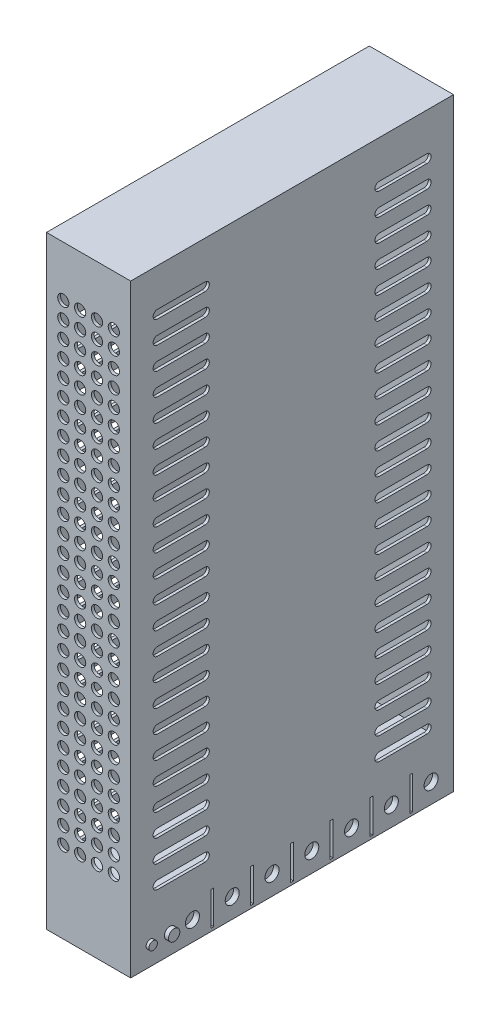
from build123d import *

# Parameters (mm, degrees)
SKETCH1_W            = 30
SKETCH1_H            = 201
CASE_2_DEPTH         = 115
CASE_SHELL_T         = 1
SKETCH2_W            = 30
SKETCH2_H            = 14
TERMINAL_BLOCK_DEPTH = 115
SKETCH3_R            = 2
POT_DEPTH            = 1.5
SKETCH4_R            = 1.5
LED_DEPTH            = 1
SKETCH5_R            = 2
PERFORATION_DEPTH    = 1
VENTS_R_DEPTH        = 1
VENTS_L_START        = 1
VENTS_L_DEPTH        = 1
SKETCH8_R            = 2.5
SCREWS_DEPTH         = 2
SKETCH9_W            = 1
SKETCH9_H            = 12
BARRIERS_DEPTH       = 3


with BuildPart() as part:
    # Sketch1 → Case 2 (new body)
    with BuildSketch(Plane.XY):
        with Locations((0, 114.5)):
            Rectangle(SKETCH1_W, SKETCH1_H)
    extrude(amount=CASE_2_DEPTH)

    # Case_shell (no face opened: a closed hollow body)
    add(offset(amount=-CASE_SHELL_T, mode=Mode.PRIVATE), mode=Mode.SUBTRACT)

    # Sketch2 → Terminal_block (add)
    with BuildSketch(Plane.XY):
        with Locations((0, 7)):
            Rectangle(SKETCH2_W, SKETCH2_H)
    extrude(amount=TERMINAL_BLOCK_DEPTH)

    # Sketch3 → Pot (add)
    with BuildSketch(Plane(origin=(15, 0, 0), x_dir=(0, 0, -1), z_dir=(1, 0, 0))):
        with Locations((-101, 7)):
            Circle(SKETCH3_R)
    extrude(amount=POT_DEPTH)

    # Sketch4 → LED (add)
    with BuildSketch(Plane(origin=(15, 0, 0), x_dir=(0, 0, -1), z_dir=(1, 0, 0))):
        with Locations((-108, 7)):
            Circle(SKETCH4_R)
    extrude(amount=LED_DEPTH)

    # Sketch5 → Perforation (cut)
    with BuildSketch(Plane.XY.offset(115)):
        with Locations((-9, 29)):
            Circle(SKETCH5_R)
        with Locations((-9, 35)):
            Circle(SKETCH5_R)
        with Locations((-9, 41)):
            Circle(SKETCH5_R)
        with Locations((-9, 47)):
            Circle(SKETCH5_R)
        with Locations((-9, 53)):
            Circle(SKETCH5_R)
        with Locations((-9, 59)):
            Circle(SKETCH5_R)
        with Locations((-9, 65)):
            Circle(SKETCH5_R)
        with Locations((-9, 71)):
            Circle(SKETCH5_R)
        with Locations((-9, 77)):
            Circle(SKETCH5_R)
        with Locations((-9, 83)):
            Circle(SKETCH5_R)
        with Locations((-9, 89)):
            Circle(SKETCH5_R)
        with Locations((-9, 95)):
            Circle(SKETCH5_R)
        with Locations((-9, 101)):
            Circle(SKETCH5_R)
        with Locations((-9, 107)):
            Circle(SKETCH5_R)
        with Locations((-9, 113)):
            Circle(SKETCH5_R)
        with Locations((-9, 119)):
            Circle(SKETCH5_R)
        with Locations((-9, 125)):
            Circle(SKETCH5_R)
        with Locations((-9, 131)):
            Circle(SKETCH5_R)
        with Locations((-9, 137)):
            Circle(SKETCH5_R)
        with Locations((-9, 143)):
            Circle(SKETCH5_R)
        with Locations((-9, 149)):
            Circle(SKETCH5_R)
        with Locations((-9, 155)):
            Circle(SKETCH5_R)
        with Locations((-9, 161)):
            Circle(SKETCH5_R)
        with Locations((-9, 167)):
            Circle(SKETCH5_R)
        with Locations((-9, 173)):
            Circle(SKETCH5_R)
        with Locations((-9, 179)):
            Circle(SKETCH5_R)
        with Locations((-9, 185)):
            Circle(SKETCH5_R)
        with Locations((-9, 191)):
            Circle(SKETCH5_R)
        with Locations((-9, 197)):
            Circle(SKETCH5_R)
        with Locations((-3, 29)):
            Circle(SKETCH5_R)
        with Locations((-3, 35)):
            Circle(SKETCH5_R)
        with Locations((-3, 41)):
            Circle(SKETCH5_R)
        with Locations((-3, 47)):
            Circle(SKETCH5_R)
        with Locations((-3, 53)):
            Circle(SKETCH5_R)
        with Locations((-3, 59)):
            Circle(SKETCH5_R)
        with Locations((-3, 65)):
            Circle(SKETCH5_R)
        with Locations((-3, 71)):
            Circle(SKETCH5_R)
        with Locations((-3, 77)):
            Circle(SKETCH5_R)
        with Locations((-3, 83)):
            Circle(SKETCH5_R)
        with Locations((-3, 89)):
            Circle(SKETCH5_R)
        with Locations((-3, 95)):
            Circle(SKETCH5_R)
        with Locations((-3, 101)):
            Circle(SKETCH5_R)
        with Locations((-3, 107)):
            Circle(SKETCH5_R)
        with Locations((-3, 113)):
            Circle(SKETCH5_R)
        with Locations((-3, 119)):
            Circle(SKETCH5_R)
        with Locations((-3, 125)):
            Circle(SKETCH5_R)
        with Locations((-3, 131)):
            Circle(SKETCH5_R)
        with Locations((-3, 137)):
            Circle(SKETCH5_R)
        with Locations((-3, 143)):
            Circle(SKETCH5_R)
        with Locations((-3, 149)):
            Circle(SKETCH5_R)
        with Locations((-3, 155)):
            Circle(SKETCH5_R)
        with Locations((-3, 161)):
            Circle(SKETCH5_R)
        with Locations((-3, 167)):
            Circle(SKETCH5_R)
        with Locations((-3, 173)):
            Circle(SKETCH5_R)
        with Locations((-3, 179)):
            Circle(SKETCH5_R)
        with Locations((-3, 185)):
            Circle(SKETCH5_R)
        with Locations((-3, 191)):
            Circle(SKETCH5_R)
        with Locations((-3, 197)):
            Circle(SKETCH5_R)
        with Locations((3, 29)):
            Circle(SKETCH5_R)
        with Locations((3, 35)):
            Circle(SKETCH5_R)
        with Locations((3, 41)):
            Circle(SKETCH5_R)
        with Locations((3, 47)):
            Circle(SKETCH5_R)
        with Locations((3, 53)):
            Circle(SKETCH5_R)
        with Locations((3, 59)):
            Circle(SKETCH5_R)
        with Locations((3, 65)):
            Circle(SKETCH5_R)
        with Locations((3, 71)):
            Circle(SKETCH5_R)
        with Locations((3, 77)):
            Circle(SKETCH5_R)
        with Locations((3, 83)):
            Circle(SKETCH5_R)
        with Locations((3, 89)):
            Circle(SKETCH5_R)
        with Locations((3, 95)):
            Circle(SKETCH5_R)
        with Locations((3, 101)):
            Circle(SKETCH5_R)
        with Locations((3, 107)):
            Circle(SKETCH5_R)
        with Locations((3, 113)):
            Circle(SKETCH5_R)
        with Locations((3, 119)):
            Circle(SKETCH5_R)
        with Locations((3, 125)):
            Circle(SKETCH5_R)
        with Locations((3, 131)):
            Circle(SKETCH5_R)
        with Locations((3, 137)):
            Circle(SKETCH5_R)
        with Locations((3, 143)):
            Circle(SKETCH5_R)
        with Locations((3, 149)):
            Circle(SKETCH5_R)
        with Locations((3, 155)):
            Circle(SKETCH5_R)
        with Locations((3, 161)):
            Circle(SKETCH5_R)
        with Locations((3, 167)):
            Circle(SKETCH5_R)
        with Locations((3, 173)):
            Circle(SKETCH5_R)
        with Locations((3, 179)):
            Circle(SKETCH5_R)
        with Locations((3, 185)):
            Circle(SKETCH5_R)
        with Locations((3, 191)):
            Circle(SKETCH5_R)
        with Locations((3, 197)):
            Circle(SKETCH5_R)
        with Locations((9, 29)):
            Circle(SKETCH5_R)
        with Locations((9, 35)):
            Circle(SKETCH5_R)
        with Locations((9, 41)):
            Circle(SKETCH5_R)
        with Locations((9, 47)):
            Circle(SKETCH5_R)
        with Locations((9, 53)):
            Circle(SKETCH5_R)
        with Locations((9, 59)):
            Circle(SKETCH5_R)
        with Locations((9, 65)):
            Circle(SKETCH5_R)
        with Locations((9, 71)):
            Circle(SKETCH5_R)
        with Locations((9, 77)):
            Circle(SKETCH5_R)
        with Locations((9, 83)):
            Circle(SKETCH5_R)
        with Locations((9, 89)):
            Circle(SKETCH5_R)
        with Locations((9, 95)):
            Circle(SKETCH5_R)
        with Locations((9, 101)):
            Circle(SKETCH5_R)
        with Locations((9, 107)):
            Circle(SKETCH5_R)
        with Locations((9, 113)):
            Circle(SKETCH5_R)
        with Locations((9, 119)):
            Circle(SKETCH5_R)
        with Locations((9, 125)):
            Circle(SKETCH5_R)
        with Locations((9, 131)):
            Circle(SKETCH5_R)
        with Locations((9, 137)):
            Circle(SKETCH5_R)
        with Locations((9, 143)):
            Circle(SKETCH5_R)
        with Locations((9, 149)):
            Circle(SKETCH5_R)
        with Locations((9, 155)):
            Circle(SKETCH5_R)
        with Locations((9, 161)):
            Circle(SKETCH5_R)
        with Locations((9, 167)):
            Circle(SKETCH5_R)
        with Locations((9, 173)):
            Circle(SKETCH5_R)
        with Locations((9, 179)):
            Circle(SKETCH5_R)
        with Locations((9, 185)):
            Circle(SKETCH5_R)
        with Locations((9, 191)):
            Circle(SKETCH5_R)
        with Locations((9, 197)):
            Circle(SKETCH5_R)
    extrude(amount=-PERFORATION_DEPTH, mode=Mode.SUBTRACT)

    # Sketch6 → Vents_R (cut)
    with BuildSketch(Plane(origin=(15, 0, 0), x_dir=(0, 0, -1), z_dir=(1, 0, 0))):
        with BuildLine():
            Line((-9.5, 22.5), (-26.5, 22.5))
            ThreePointArc((-26.5, 22.5), (-28, 24), (-26.5, 25.5))
            Line((-26.5, 25.5), (-9.5, 25.5))
            ThreePointArc((-9.5, 25.5), (-8, 24), (-9.5, 22.5))
        make_face()
        with BuildLine():
            Line((-88.5, 22.5), (-105.5, 22.5))
            ThreePointArc((-105.5, 22.5), (-107, 24), (-105.5, 25.5))
            Line((-105.5, 25.5), (-88.5, 25.5))
            ThreePointArc((-88.5, 25.5), (-87, 24), (-88.5, 22.5))
        make_face()
        with BuildLine():
            Line((-9.5, 30.5), (-26.5, 30.5))
            ThreePointArc((-26.5, 30.5), (-28, 32), (-26.5, 33.5))
            Line((-26.5, 33.5), (-9.5, 33.5))
            ThreePointArc((-9.5, 33.5), (-8, 32), (-9.5, 30.5))
        make_face()
        with BuildLine():
            Line((-88.5, 30.5), (-105.5, 30.5))
            ThreePointArc((-105.5, 30.5), (-107, 32), (-105.5, 33.5))
            Line((-105.5, 33.5), (-88.5, 33.5))
            ThreePointArc((-88.5, 33.5), (-87, 32), (-88.5, 30.5))
        make_face()
        with BuildLine():
            Line((-9.5, 38.5), (-26.5, 38.5))
            ThreePointArc((-26.5, 38.5), (-28, 40), (-26.5, 41.5))
            Line((-26.5, 41.5), (-9.5, 41.5))
            ThreePointArc((-9.5, 41.5), (-8, 40), (-9.5, 38.5))
        make_face()
        with BuildLine():
            Line((-88.5, 38.5), (-105.5, 38.5))
            ThreePointArc((-105.5, 38.5), (-107, 40), (-105.5, 41.5))
            Line((-105.5, 41.5), (-88.5, 41.5))
            ThreePointArc((-88.5, 41.5), (-87, 40), (-88.5, 38.5))
        make_face()
        with BuildLine():
            Line((-9.5, 46.5), (-26.5, 46.5))
            ThreePointArc((-26.5, 46.5), (-28, 48), (-26.5, 49.5))
            Line((-26.5, 49.5), (-9.5, 49.5))
            ThreePointArc((-9.5, 49.5), (-8, 48), (-9.5, 46.5))
        make_face()
        with BuildLine():
            Line((-88.5, 46.5), (-105.5, 46.5))
            ThreePointArc((-105.5, 46.5), (-107, 48), (-105.5, 49.5))
            Line((-105.5, 49.5), (-88.5, 49.5))
            ThreePointArc((-88.5, 49.5), (-87, 48), (-88.5, 46.5))
        make_face()
        with BuildLine():
            Line((-9.5, 54.5), (-26.5, 54.5))
            ThreePointArc((-26.5, 54.5), (-28, 56), (-26.5, 57.5))
            Line((-26.5, 57.5), (-9.5, 57.5))
            ThreePointArc((-9.5, 57.5), (-8, 56), (-9.5, 54.5))
        make_face()
        with BuildLine():
            Line((-88.5, 54.5), (-105.5, 54.5))
            ThreePointArc((-105.5, 54.5), (-107, 56), (-105.5, 57.5))
            Line((-105.5, 57.5), (-88.5, 57.5))
            ThreePointArc((-88.5, 57.5), (-87, 56), (-88.5, 54.5))
        make_face()
        with BuildLine():
            Line((-9.5, 62.5), (-26.5, 62.5))
            ThreePointArc((-26.5, 62.5), (-28, 64), (-26.5, 65.5))
            Line((-26.5, 65.5), (-9.5, 65.5))
            ThreePointArc((-9.5, 65.5), (-8, 64), (-9.5, 62.5))
        make_face()
        with BuildLine():
            Line((-88.5, 62.5), (-105.5, 62.5))
            ThreePointArc((-105.5, 62.5), (-107, 64), (-105.5, 65.5))
            Line((-105.5, 65.5), (-88.5, 65.5))
            ThreePointArc((-88.5, 65.5), (-87, 64), (-88.5, 62.5))
        make_face()
        with BuildLine():
            Line((-9.5, 70.5), (-26.5, 70.5))
            ThreePointArc((-26.5, 70.5), (-28, 72), (-26.5, 73.5))
            Line((-26.5, 73.5), (-9.5, 73.5))
            ThreePointArc((-9.5, 73.5), (-8, 72), (-9.5, 70.5))
        make_face()
        with BuildLine():
            Line((-88.5, 70.5), (-105.5, 70.5))
            ThreePointArc((-105.5, 70.5), (-107, 72), (-105.5, 73.5))
            Line((-105.5, 73.5), (-88.5, 73.5))
            ThreePointArc((-88.5, 73.5), (-87, 72), (-88.5, 70.5))
        make_face()
        with BuildLine():
            Line((-9.5, 78.5), (-26.5, 78.5))
            ThreePointArc((-26.5, 78.5), (-28, 80), (-26.5, 81.5))
            Line((-26.5, 81.5), (-9.5, 81.5))
            ThreePointArc((-9.5, 81.5), (-8, 80), (-9.5, 78.5))
        make_face()
        with BuildLine():
            Line((-88.5, 78.5), (-105.5, 78.5))
            ThreePointArc((-105.5, 78.5), (-107, 80), (-105.5, 81.5))
            Line((-105.5, 81.5), (-88.5, 81.5))
            ThreePointArc((-88.5, 81.5), (-87, 80), (-88.5, 78.5))
        make_face()
        with BuildLine():
            Line((-9.5, 86.5), (-26.5, 86.5))
            ThreePointArc((-26.5, 86.5), (-28, 88), (-26.5, 89.5))
            Line((-26.5, 89.5), (-9.5, 89.5))
            ThreePointArc((-9.5, 89.5), (-8, 88), (-9.5, 86.5))
        make_face()
        with BuildLine():
            Line((-88.5, 86.5), (-105.5, 86.5))
            ThreePointArc((-105.5, 86.5), (-107, 88), (-105.5, 89.5))
            Line((-105.5, 89.5), (-88.5, 89.5))
            ThreePointArc((-88.5, 89.5), (-87, 88), (-88.5, 86.5))
        make_face()
        with BuildLine():
            Line((-9.5, 94.5), (-26.5, 94.5))
            ThreePointArc((-26.5, 94.5), (-28, 96), (-26.5, 97.5))
            Line((-26.5, 97.5), (-9.5, 97.5))
            ThreePointArc((-9.5, 97.5), (-8, 96), (-9.5, 94.5))
        make_face()
        with BuildLine():
            Line((-88.5, 94.5), (-105.5, 94.5))
            ThreePointArc((-105.5, 94.5), (-107, 96), (-105.5, 97.5))
            Line((-105.5, 97.5), (-88.5, 97.5))
            ThreePointArc((-88.5, 97.5), (-87, 96), (-88.5, 94.5))
        make_face()
        with BuildLine():
            Line((-9.5, 102.5), (-26.5, 102.5))
            ThreePointArc((-26.5, 102.5), (-28, 104), (-26.5, 105.5))
            Line((-26.5, 105.5), (-9.5, 105.5))
            ThreePointArc((-9.5, 105.5), (-8, 104), (-9.5, 102.5))
        make_face()
        with BuildLine():
            Line((-88.5, 102.5), (-105.5, 102.5))
            ThreePointArc((-105.5, 102.5), (-107, 104), (-105.5, 105.5))
            Line((-105.5, 105.5), (-88.5, 105.5))
            ThreePointArc((-88.5, 105.5), (-87, 104), (-88.5, 102.5))
        make_face()
        with BuildLine():
            Line((-9.5, 110.5), (-26.5, 110.5))
            ThreePointArc((-26.5, 110.5), (-28, 112), (-26.5, 113.5))
            Line((-26.5, 113.5), (-9.5, 113.5))
            ThreePointArc((-9.5, 113.5), (-8, 112), (-9.5, 110.5))
        make_face()
        with BuildLine():
            Line((-88.5, 110.5), (-105.5, 110.5))
            ThreePointArc((-105.5, 110.5), (-107, 112), (-105.5, 113.5))
            Line((-105.5, 113.5), (-88.5, 113.5))
            ThreePointArc((-88.5, 113.5), (-87, 112), (-88.5, 110.5))
        make_face()
        with BuildLine():
            Line((-9.5, 118.5), (-26.5, 118.5))
            ThreePointArc((-26.5, 118.5), (-28, 120), (-26.5, 121.5))
            Line((-26.5, 121.5), (-9.5, 121.5))
            ThreePointArc((-9.5, 121.5), (-8, 120), (-9.5, 118.5))
        make_face()
        with BuildLine():
            Line((-88.5, 118.5), (-105.5, 118.5))
            ThreePointArc((-105.5, 118.5), (-107, 120), (-105.5, 121.5))
            Line((-105.5, 121.5), (-88.5, 121.5))
            ThreePointArc((-88.5, 121.5), (-87, 120), (-88.5, 118.5))
        make_face()
        with BuildLine():
            Line((-9.5, 126.5), (-26.5, 126.5))
            ThreePointArc((-26.5, 126.5), (-28, 128), (-26.5, 129.5))
            Line((-26.5, 129.5), (-9.5, 129.5))
            ThreePointArc((-9.5, 129.5), (-8, 128), (-9.5, 126.5))
        make_face()
        with BuildLine():
            Line((-88.5, 126.5), (-105.5, 126.5))
            ThreePointArc((-105.5, 126.5), (-107, 128), (-105.5, 129.5))
            Line((-105.5, 129.5), (-88.5, 129.5))
            ThreePointArc((-88.5, 129.5), (-87, 128), (-88.5, 126.5))
        make_face()
        with BuildLine():
            Line((-9.5, 134.5), (-26.5, 134.5))
            ThreePointArc((-26.5, 134.5), (-28, 136), (-26.5, 137.5))
            Line((-26.5, 137.5), (-9.5, 137.5))
            ThreePointArc((-9.5, 137.5), (-8, 136), (-9.5, 134.5))
        make_face()
        with BuildLine():
            Line((-88.5, 134.5), (-105.5, 134.5))
            ThreePointArc((-105.5, 134.5), (-107, 136), (-105.5, 137.5))
            Line((-105.5, 137.5), (-88.5, 137.5))
            ThreePointArc((-88.5, 137.5), (-87, 136), (-88.5, 134.5))
        make_face()
        with BuildLine():
            Line((-9.5, 142.5), (-26.5, 142.5))
            ThreePointArc((-26.5, 142.5), (-28, 144), (-26.5, 145.5))
            Line((-26.5, 145.5), (-9.5, 145.5))
            ThreePointArc((-9.5, 145.5), (-8, 144), (-9.5, 142.5))
        make_face()
        with BuildLine():
            Line((-88.5, 142.5), (-105.5, 142.5))
            ThreePointArc((-105.5, 142.5), (-107, 144), (-105.5, 145.5))
            Line((-105.5, 145.5), (-88.5, 145.5))
            ThreePointArc((-88.5, 145.5), (-87, 144), (-88.5, 142.5))
        make_face()
        with BuildLine():
            Line((-9.5, 150.5), (-26.5, 150.5))
            ThreePointArc((-26.5, 150.5), (-28, 152), (-26.5, 153.5))
            Line((-26.5, 153.5), (-9.5, 153.5))
            ThreePointArc((-9.5, 153.5), (-8, 152), (-9.5, 150.5))
        make_face()
        with BuildLine():
            Line((-88.5, 150.5), (-105.5, 150.5))
            ThreePointArc((-105.5, 150.5), (-107, 152), (-105.5, 153.5))
            Line((-105.5, 153.5), (-88.5, 153.5))
            ThreePointArc((-88.5, 153.5), (-87, 152), (-88.5, 150.5))
        make_face()
        with BuildLine():
            Line((-9.5, 158.5), (-26.5, 158.5))
            ThreePointArc((-26.5, 158.5), (-28, 160), (-26.5, 161.5))
            Line((-26.5, 161.5), (-9.5, 161.5))
            ThreePointArc((-9.5, 161.5), (-8, 160), (-9.5, 158.5))
        make_face()
        with BuildLine():
            Line((-88.5, 158.5), (-105.5, 158.5))
            ThreePointArc((-105.5, 158.5), (-107, 160), (-105.5, 161.5))
            Line((-105.5, 161.5), (-88.5, 161.5))
            ThreePointArc((-88.5, 161.5), (-87, 160), (-88.5, 158.5))
        make_face()
        with BuildLine():
            Line((-9.5, 166.5), (-26.5, 166.5))
            ThreePointArc((-26.5, 166.5), (-28, 168), (-26.5, 169.5))
            Line((-26.5, 169.5), (-9.5, 169.5))
            ThreePointArc((-9.5, 169.5), (-8, 168), (-9.5, 166.5))
        make_face()
        with BuildLine():
            Line((-88.5, 166.5), (-105.5, 166.5))
            ThreePointArc((-105.5, 166.5), (-107, 168), (-105.5, 169.5))
            Line((-105.5, 169.5), (-88.5, 169.5))
            ThreePointArc((-88.5, 169.5), (-87, 168), (-88.5, 166.5))
        make_face()
        with BuildLine():
            Line((-9.5, 174.5), (-26.5, 174.5))
            ThreePointArc((-26.5, 174.5), (-28, 176), (-26.5, 177.5))
            Line((-26.5, 177.5), (-9.5, 177.5))
            ThreePointArc((-9.5, 177.5), (-8, 176), (-9.5, 174.5))
        make_face()
        with BuildLine():
            Line((-88.5, 174.5), (-105.5, 174.5))
            ThreePointArc((-105.5, 174.5), (-107, 176), (-105.5, 177.5))
            Line((-105.5, 177.5), (-88.5, 177.5))
            ThreePointArc((-88.5, 177.5), (-87, 176), (-88.5, 174.5))
        make_face()
        with BuildLine():
            Line((-9.5, 182.5), (-26.5, 182.5))
            ThreePointArc((-26.5, 182.5), (-28, 184), (-26.5, 185.5))
            Line((-26.5, 185.5), (-9.5, 185.5))
            ThreePointArc((-9.5, 185.5), (-8, 184), (-9.5, 182.5))
        make_face()
        with BuildLine():
            Line((-88.5, 182.5), (-105.5, 182.5))
            ThreePointArc((-105.5, 182.5), (-107, 184), (-105.5, 185.5))
            Line((-105.5, 185.5), (-88.5, 185.5))
            ThreePointArc((-88.5, 185.5), (-87, 184), (-88.5, 182.5))
        make_face()
        with BuildLine():
            Line((-9.5, 190.5), (-26.5, 190.5))
            ThreePointArc((-26.5, 190.5), (-28, 192), (-26.5, 193.5))
            Line((-26.5, 193.5), (-9.5, 193.5))
            ThreePointArc((-9.5, 193.5), (-8, 192), (-9.5, 190.5))
        make_face()
        with BuildLine():
            Line((-88.5, 190.5), (-105.5, 190.5))
            ThreePointArc((-105.5, 190.5), (-107, 192), (-105.5, 193.5))
            Line((-105.5, 193.5), (-88.5, 193.5))
            ThreePointArc((-88.5, 193.5), (-87, 192), (-88.5, 190.5))
        make_face()
        with BuildLine():
            Line((-9.5, 198.5), (-26.5, 198.5))
            ThreePointArc((-26.5, 198.5), (-28, 200), (-26.5, 201.5))
            Line((-26.5, 201.5), (-9.5, 201.5))
            ThreePointArc((-9.5, 201.5), (-8, 200), (-9.5, 198.5))
        make_face()
        with BuildLine():
            Line((-88.5, 198.5), (-105.5, 198.5))
            ThreePointArc((-105.5, 198.5), (-107, 200), (-105.5, 201.5))
            Line((-105.5, 201.5), (-88.5, 201.5))
            ThreePointArc((-88.5, 201.5), (-87, 200), (-88.5, 198.5))
        make_face()
    extrude(amount=-VENTS_R_DEPTH, mode=Mode.SUBTRACT)

    # Sketch7 → Vents_L (cut)
    with BuildSketch(Plane(origin=(-15, 0, 0), x_dir=(0, 0, -1), z_dir=(1, 0, 0)).offset(VENTS_L_START)):
        with BuildLine():
            Line((-9.5, 22.5), (-26.5, 22.5))
            ThreePointArc((-26.5, 22.5), (-28, 24), (-26.5, 25.5))
            Line((-26.5, 25.5), (-9.5, 25.5))
            ThreePointArc((-9.5, 25.5), (-8, 24), (-9.5, 22.5))
        make_face()
        with BuildLine():
            Line((-88.5, 22.5), (-105.5, 22.5))
            ThreePointArc((-105.5, 22.5), (-107, 24), (-105.5, 25.5))
            Line((-105.5, 25.5), (-88.5, 25.5))
            ThreePointArc((-88.5, 25.5), (-87, 24), (-88.5, 22.5))
        make_face()
        with BuildLine():
            Line((-9.5, 30.5), (-26.5, 30.5))
            ThreePointArc((-26.5, 30.5), (-28, 32), (-26.5, 33.5))
            Line((-26.5, 33.5), (-9.5, 33.5))
            ThreePointArc((-9.5, 33.5), (-8, 32), (-9.5, 30.5))
        make_face()
        with BuildLine():
            Line((-88.5, 30.5), (-105.5, 30.5))
            ThreePointArc((-105.5, 30.5), (-107, 32), (-105.5, 33.5))
            Line((-105.5, 33.5), (-88.5, 33.5))
            ThreePointArc((-88.5, 33.5), (-87, 32), (-88.5, 30.5))
        make_face()
        with BuildLine():
            Line((-9.5, 38.5), (-26.5, 38.5))
            ThreePointArc((-26.5, 38.5), (-28, 40), (-26.5, 41.5))
            Line((-26.5, 41.5), (-9.5, 41.5))
            ThreePointArc((-9.5, 41.5), (-8, 40), (-9.5, 38.5))
        make_face()
        with BuildLine():
            Line((-88.5, 38.5), (-105.5, 38.5))
            ThreePointArc((-105.5, 38.5), (-107, 40), (-105.5, 41.5))
            Line((-105.5, 41.5), (-88.5, 41.5))
            ThreePointArc((-88.5, 41.5), (-87, 40), (-88.5, 38.5))
        make_face()
        with BuildLine():
            Line((-9.5, 46.5), (-26.5, 46.5))
            ThreePointArc((-26.5, 46.5), (-28, 48), (-26.5, 49.5))
            Line((-26.5, 49.5), (-9.5, 49.5))
            ThreePointArc((-9.5, 49.5), (-8, 48), (-9.5, 46.5))
        make_face()
        with BuildLine():
            Line((-88.5, 46.5), (-105.5, 46.5))
            ThreePointArc((-105.5, 46.5), (-107, 48), (-105.5, 49.5))
            Line((-105.5, 49.5), (-88.5, 49.5))
            ThreePointArc((-88.5, 49.5), (-87, 48), (-88.5, 46.5))
        make_face()
        with BuildLine():
            Line((-9.5, 54.5), (-26.5, 54.5))
            ThreePointArc((-26.5, 54.5), (-28, 56), (-26.5, 57.5))
            Line((-26.5, 57.5), (-9.5, 57.5))
            ThreePointArc((-9.5, 57.5), (-8, 56), (-9.5, 54.5))
        make_face()
        with BuildLine():
            Line((-88.5, 54.5), (-105.5, 54.5))
            ThreePointArc((-105.5, 54.5), (-107, 56), (-105.5, 57.5))
            Line((-105.5, 57.5), (-88.5, 57.5))
            ThreePointArc((-88.5, 57.5), (-87, 56), (-88.5, 54.5))
        make_face()
        with BuildLine():
            Line((-9.5, 62.5), (-26.5, 62.5))
            ThreePointArc((-26.5, 62.5), (-28, 64), (-26.5, 65.5))
            Line((-26.5, 65.5), (-9.5, 65.5))
            ThreePointArc((-9.5, 65.5), (-8, 64), (-9.5, 62.5))
        make_face()
        with BuildLine():
            Line((-88.5, 62.5), (-105.5, 62.5))
            ThreePointArc((-105.5, 62.5), (-107, 64), (-105.5, 65.5))
            Line((-105.5, 65.5), (-88.5, 65.5))
            ThreePointArc((-88.5, 65.5), (-87, 64), (-88.5, 62.5))
        make_face()
        with BuildLine():
            Line((-9.5, 70.5), (-26.5, 70.5))
            ThreePointArc((-26.5, 70.5), (-28, 72), (-26.5, 73.5))
            Line((-26.5, 73.5), (-9.5, 73.5))
            ThreePointArc((-9.5, 73.5), (-8, 72), (-9.5, 70.5))
        make_face()
        with BuildLine():
            Line((-88.5, 70.5), (-105.5, 70.5))
            ThreePointArc((-105.5, 70.5), (-107, 72), (-105.5, 73.5))
            Line((-105.5, 73.5), (-88.5, 73.5))
            ThreePointArc((-88.5, 73.5), (-87, 72), (-88.5, 70.5))
        make_face()
        with BuildLine():
            Line((-9.5, 78.5), (-26.5, 78.5))
            ThreePointArc((-26.5, 78.5), (-28, 80), (-26.5, 81.5))
            Line((-26.5, 81.5), (-9.5, 81.5))
            ThreePointArc((-9.5, 81.5), (-8, 80), (-9.5, 78.5))
        make_face()
        with BuildLine():
            Line((-88.5, 78.5), (-105.5, 78.5))
            ThreePointArc((-105.5, 78.5), (-107, 80), (-105.5, 81.5))
            Line((-105.5, 81.5), (-88.5, 81.5))
            ThreePointArc((-88.5, 81.5), (-87, 80), (-88.5, 78.5))
        make_face()
        with BuildLine():
            Line((-9.5, 86.5), (-26.5, 86.5))
            ThreePointArc((-26.5, 86.5), (-28, 88), (-26.5, 89.5))
            Line((-26.5, 89.5), (-9.5, 89.5))
            ThreePointArc((-9.5, 89.5), (-8, 88), (-9.5, 86.5))
        make_face()
        with BuildLine():
            Line((-88.5, 86.5), (-105.5, 86.5))
            ThreePointArc((-105.5, 86.5), (-107, 88), (-105.5, 89.5))
            Line((-105.5, 89.5), (-88.5, 89.5))
            ThreePointArc((-88.5, 89.5), (-87, 88), (-88.5, 86.5))
        make_face()
        with BuildLine():
            Line((-9.5, 94.5), (-26.5, 94.5))
            ThreePointArc((-26.5, 94.5), (-28, 96), (-26.5, 97.5))
            Line((-26.5, 97.5), (-9.5, 97.5))
            ThreePointArc((-9.5, 97.5), (-8, 96), (-9.5, 94.5))
        make_face()
        with BuildLine():
            Line((-88.5, 94.5), (-105.5, 94.5))
            ThreePointArc((-105.5, 94.5), (-107, 96), (-105.5, 97.5))
            Line((-105.5, 97.5), (-88.5, 97.5))
            ThreePointArc((-88.5, 97.5), (-87, 96), (-88.5, 94.5))
        make_face()
        with BuildLine():
            Line((-9.5, 102.5), (-26.5, 102.5))
            ThreePointArc((-26.5, 102.5), (-28, 104), (-26.5, 105.5))
            Line((-26.5, 105.5), (-9.5, 105.5))
            ThreePointArc((-9.5, 105.5), (-8, 104), (-9.5, 102.5))
        make_face()
        with BuildLine():
            Line((-88.5, 102.5), (-105.5, 102.5))
            ThreePointArc((-105.5, 102.5), (-107, 104), (-105.5, 105.5))
            Line((-105.5, 105.5), (-88.5, 105.5))
            ThreePointArc((-88.5, 105.5), (-87, 104), (-88.5, 102.5))
        make_face()
        with BuildLine():
            Line((-9.5, 110.5), (-26.5, 110.5))
            ThreePointArc((-26.5, 110.5), (-28, 112), (-26.5, 113.5))
            Line((-26.5, 113.5), (-9.5, 113.5))
            ThreePointArc((-9.5, 113.5), (-8, 112), (-9.5, 110.5))
        make_face()
        with BuildLine():
            Line((-88.5, 110.5), (-105.5, 110.5))
            ThreePointArc((-105.5, 110.5), (-107, 112), (-105.5, 113.5))
            Line((-105.5, 113.5), (-88.5, 113.5))
            ThreePointArc((-88.5, 113.5), (-87, 112), (-88.5, 110.5))
        make_face()
        with BuildLine():
            Line((-9.5, 118.5), (-26.5, 118.5))
            ThreePointArc((-26.5, 118.5), (-28, 120), (-26.5, 121.5))
            Line((-26.5, 121.5), (-9.5, 121.5))
            ThreePointArc((-9.5, 121.5), (-8, 120), (-9.5, 118.5))
        make_face()
        with BuildLine():
            Line((-88.5, 118.5), (-105.5, 118.5))
            ThreePointArc((-105.5, 118.5), (-107, 120), (-105.5, 121.5))
            Line((-105.5, 121.5), (-88.5, 121.5))
            ThreePointArc((-88.5, 121.5), (-87, 120), (-88.5, 118.5))
        make_face()
        with BuildLine():
            Line((-9.5, 126.5), (-26.5, 126.5))
            ThreePointArc((-26.5, 126.5), (-28, 128), (-26.5, 129.5))
            Line((-26.5, 129.5), (-9.5, 129.5))
            ThreePointArc((-9.5, 129.5), (-8, 128), (-9.5, 126.5))
        make_face()
        with BuildLine():
            Line((-88.5, 126.5), (-105.5, 126.5))
            ThreePointArc((-105.5, 126.5), (-107, 128), (-105.5, 129.5))
            Line((-105.5, 129.5), (-88.5, 129.5))
            ThreePointArc((-88.5, 129.5), (-87, 128), (-88.5, 126.5))
        make_face()
        with BuildLine():
            Line((-9.5, 134.5), (-26.5, 134.5))
            ThreePointArc((-26.5, 134.5), (-28, 136), (-26.5, 137.5))
            Line((-26.5, 137.5), (-9.5, 137.5))
            ThreePointArc((-9.5, 137.5), (-8, 136), (-9.5, 134.5))
        make_face()
        with BuildLine():
            Line((-88.5, 134.5), (-105.5, 134.5))
            ThreePointArc((-105.5, 134.5), (-107, 136), (-105.5, 137.5))
            Line((-105.5, 137.5), (-88.5, 137.5))
            ThreePointArc((-88.5, 137.5), (-87, 136), (-88.5, 134.5))
        make_face()
        with BuildLine():
            Line((-9.5, 142.5), (-26.5, 142.5))
            ThreePointArc((-26.5, 142.5), (-28, 144), (-26.5, 145.5))
            Line((-26.5, 145.5), (-9.5, 145.5))
            ThreePointArc((-9.5, 145.5), (-8, 144), (-9.5, 142.5))
        make_face()
        with BuildLine():
            Line((-88.5, 142.5), (-105.5, 142.5))
            ThreePointArc((-105.5, 142.5), (-107, 144), (-105.5, 145.5))
            Line((-105.5, 145.5), (-88.5, 145.5))
            ThreePointArc((-88.5, 145.5), (-87, 144), (-88.5, 142.5))
        make_face()
        with BuildLine():
            Line((-9.5, 150.5), (-26.5, 150.5))
            ThreePointArc((-26.5, 150.5), (-28, 152), (-26.5, 153.5))
            Line((-26.5, 153.5), (-9.5, 153.5))
            ThreePointArc((-9.5, 153.5), (-8, 152), (-9.5, 150.5))
        make_face()
        with BuildLine():
            Line((-88.5, 150.5), (-105.5, 150.5))
            ThreePointArc((-105.5, 150.5), (-107, 152), (-105.5, 153.5))
            Line((-105.5, 153.5), (-88.5, 153.5))
            ThreePointArc((-88.5, 153.5), (-87, 152), (-88.5, 150.5))
        make_face()
        with BuildLine():
            Line((-9.5, 158.5), (-26.5, 158.5))
            ThreePointArc((-26.5, 158.5), (-28, 160), (-26.5, 161.5))
            Line((-26.5, 161.5), (-9.5, 161.5))
            ThreePointArc((-9.5, 161.5), (-8, 160), (-9.5, 158.5))
        make_face()
        with BuildLine():
            Line((-88.5, 158.5), (-105.5, 158.5))
            ThreePointArc((-105.5, 158.5), (-107, 160), (-105.5, 161.5))
            Line((-105.5, 161.5), (-88.5, 161.5))
            ThreePointArc((-88.5, 161.5), (-87, 160), (-88.5, 158.5))
        make_face()
        with BuildLine():
            Line((-9.5, 166.5), (-26.5, 166.5))
            ThreePointArc((-26.5, 166.5), (-28, 168), (-26.5, 169.5))
            Line((-26.5, 169.5), (-9.5, 169.5))
            ThreePointArc((-9.5, 169.5), (-8, 168), (-9.5, 166.5))
        make_face()
        with BuildLine():
            Line((-88.5, 166.5), (-105.5, 166.5))
            ThreePointArc((-105.5, 166.5), (-107, 168), (-105.5, 169.5))
            Line((-105.5, 169.5), (-88.5, 169.5))
            ThreePointArc((-88.5, 169.5), (-87, 168), (-88.5, 166.5))
        make_face()
        with BuildLine():
            Line((-9.5, 174.5), (-26.5, 174.5))
            ThreePointArc((-26.5, 174.5), (-28, 176), (-26.5, 177.5))
            Line((-26.5, 177.5), (-9.5, 177.5))
            ThreePointArc((-9.5, 177.5), (-8, 176), (-9.5, 174.5))
        make_face()
        with BuildLine():
            Line((-88.5, 174.5), (-105.5, 174.5))
            ThreePointArc((-105.5, 174.5), (-107, 176), (-105.5, 177.5))
            Line((-105.5, 177.5), (-88.5, 177.5))
            ThreePointArc((-88.5, 177.5), (-87, 176), (-88.5, 174.5))
        make_face()
        with BuildLine():
            Line((-9.5, 182.5), (-26.5, 182.5))
            ThreePointArc((-26.5, 182.5), (-28, 184), (-26.5, 185.5))
            Line((-26.5, 185.5), (-9.5, 185.5))
            ThreePointArc((-9.5, 185.5), (-8, 184), (-9.5, 182.5))
        make_face()
        with BuildLine():
            Line((-88.5, 182.5), (-105.5, 182.5))
            ThreePointArc((-105.5, 182.5), (-107, 184), (-105.5, 185.5))
            Line((-105.5, 185.5), (-88.5, 185.5))
            ThreePointArc((-88.5, 185.5), (-87, 184), (-88.5, 182.5))
        make_face()
        with BuildLine():
            Line((-9.5, 190.5), (-26.5, 190.5))
            ThreePointArc((-26.5, 190.5), (-28, 192), (-26.5, 193.5))
            Line((-26.5, 193.5), (-9.5, 193.5))
            ThreePointArc((-9.5, 193.5), (-8, 192), (-9.5, 190.5))
        make_face()
        with BuildLine():
            Line((-88.5, 190.5), (-105.5, 190.5))
            ThreePointArc((-105.5, 190.5), (-107, 192), (-105.5, 193.5))
            Line((-105.5, 193.5), (-88.5, 193.5))
            ThreePointArc((-88.5, 193.5), (-87, 192), (-88.5, 190.5))
        make_face()
        with BuildLine():
            Line((-9.5, 198.5), (-26.5, 198.5))
            ThreePointArc((-26.5, 198.5), (-28, 200), (-26.5, 201.5))
            Line((-26.5, 201.5), (-9.5, 201.5))
            ThreePointArc((-9.5, 201.5), (-8, 200), (-9.5, 198.5))
        make_face()
        with BuildLine():
            Line((-88.5, 198.5), (-105.5, 198.5))
            ThreePointArc((-105.5, 198.5), (-107, 200), (-105.5, 201.5))
            Line((-105.5, 201.5), (-88.5, 201.5))
            ThreePointArc((-88.5, 201.5), (-87, 200), (-88.5, 198.5))
        make_face()
    extrude(amount=-VENTS_L_DEPTH, mode=Mode.SUBTRACT)

    # Sketch8 → Screws (cut)
    with BuildSketch(Plane(origin=(15, 0, 0), x_dir=(0, 0, -1), z_dir=(1, 0, 0))):
        with Locations((-8, 7)):
            Circle(SKETCH8_R)
        with Locations((-22.166666667, 7)):
            Circle(SKETCH8_R)
        with Locations((-36.333333333, 7)):
            Circle(SKETCH8_R)
        with Locations((-50.5, 7)):
            Circle(SKETCH8_R)
        with Locations((-64.666666667, 7)):
            Circle(SKETCH8_R)
        with Locations((-78.833333333, 7)):
            Circle(SKETCH8_R)
        with Locations((-93, 7)):
            Circle(SKETCH8_R)
    extrude(amount=-SCREWS_DEPTH, mode=Mode.SUBTRACT)

    # Sketch9 → Barriers (cut)
    with BuildSketch(Plane(origin=(15, 0, 0), x_dir=(0, 0, -1), z_dir=(1, 0, 0))):
        with Locations((-15.083333333, 7)):
            Rectangle(SKETCH9_W, SKETCH9_H)
        with Locations((-29.25, 7)):
            Rectangle(SKETCH9_W, SKETCH9_H)
        with Locations((-43.416666667, 7)):
            Rectangle(SKETCH9_W, SKETCH9_H)
        with Locations((-57.583333333, 7)):
            Rectangle(SKETCH9_W, SKETCH9_H)
        with Locations((-71.75, 7)):
            Rectangle(SKETCH9_W, SKETCH9_H)
        with Locations((-85.916666667, 7)):
            Rectangle(SKETCH9_W, SKETCH9_H)
    extrude(amount=-BARRIERS_DEPTH, mode=Mode.SUBTRACT)


solid = part.part
